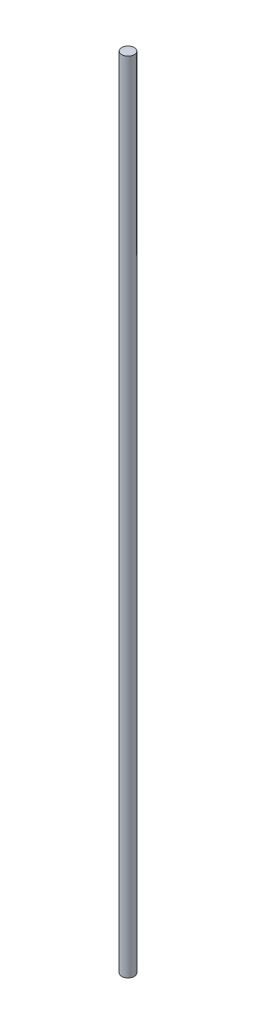
from build123d import *

# Parameters (mm, degrees)
SKETCH1_R           = 1.984375
BOSS_EXTRUDE1_DEPTH = 254


with BuildPart() as part:
    # Sketch1 → Boss-Extrude1 (new body)
    with BuildSketch(Plane(origin=(0, 0, 0), x_dir=(1, 0, 0), z_dir=(0, 1, 0))):
        Circle(SKETCH1_R)
    extrude(amount=BOSS_EXTRUDE1_DEPTH)


solid = part.part
